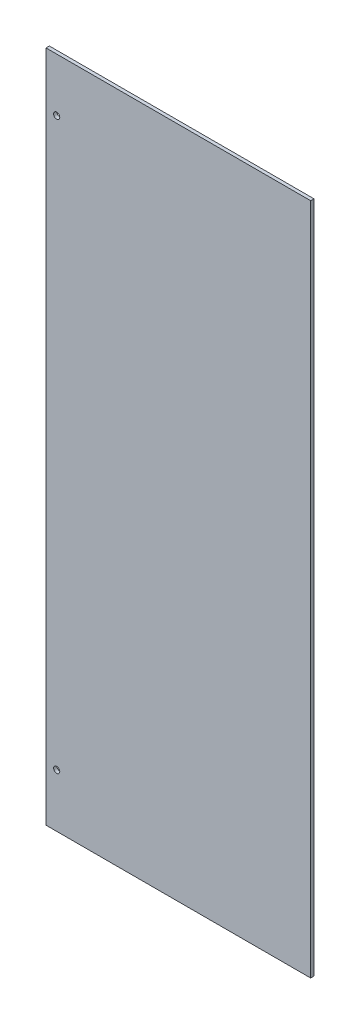
from build123d import *

# Parameters (mm, degrees)
SKETCH1_W           = 126.0475
SKETCH1_H           = 320.675
BOSS_EXTRUDE1_DEPTH = 1.5875
SKETCH2_R           = 1.4605
CUT_EXTRUDE1_DEPTH  = 6.35
LPATTERN1_COUNT     = 2
LPATTERN1_PITCH     = 269.875


with BuildPart() as part:
    # Sketch1 → Boss-Extrude1 (new body)
    with BuildSketch(Plane.XY):
        with Locations((63.02375, 160.3375)):
            Rectangle(SKETCH1_W, SKETCH1_H)
    extrude(amount=BOSS_EXTRUDE1_DEPTH)

    # Sketch2 → Cut-Extrude1 (cut)
    with BuildSketch(Plane.XY.offset(1.5875)):
        with Locations((5.08, 295.275)):
            Circle(SKETCH2_R)
    cut_extrude1 = extrude(amount=-CUT_EXTRUDE1_DEPTH, mode=Mode.SUBTRACT)

    # LPattern1: Cut-Extrude1 ×2
    with Locations(*[(0, -i * LPATTERN1_PITCH, 0) for i in range(1, LPATTERN1_COUNT)]):
        add(cut_extrude1, mode=Mode.SUBTRACT)


solid = part.part
